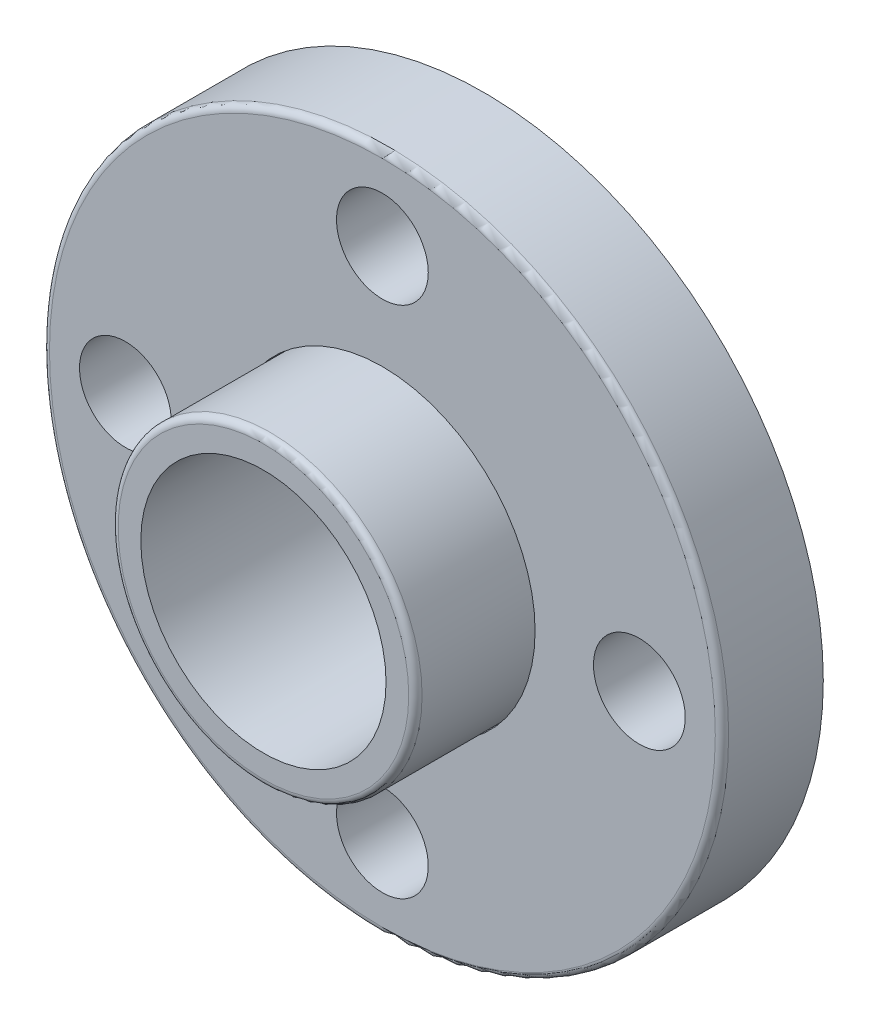
from build123d import *

# Parameters (mm, degrees)
SKETCH1_R                       = 58.7375
EXTRUDE1_DEPTH                  = 17.526
SKETCH2_R                       = 26.289
EXTRUDE2_DEPTH                  = 20.574
SKETCH3_R                       = 7.9375
EXTRUDE3_DEPTH                  = 86.577317605
CIRPATTERN1_COUNT               = 4
FILLET1_R                       = 1.154545455
CUT_REVOLVE_THIN1_OUTLINE_R     = 30.2895
CUT_REVOLVE_THIN1_OUTLINE_R_2   = 30.1625
CUT_REVOLVE_THIN1_DEPTH         = 8.312727273
CUT_REVOLVE_THIN1_START         = 8.185727273
CUT_REVOLVE_THIN1_2_OUTLINE_R   = 26.416
CUT_REVOLVE_THIN1_2_OUTLINE_R_2 = 26.289
CUT_REVOLVE_THIN1_2_DEPTH       = 9.340272727
CUT_REVOLVE_THIN1_3_OUTLINE_R   = 30.1625
CUT_REVOLVE_THIN1_3_OUTLINE_R_2 = 26.416
CUT_REVOLVE_THIN1_3_DEPTH       = 0.127


# Read off the part's stored shape, not the designer's step: Cut-Revolve-Thin1
with BuildPart() as part:
    # Sketch1 → Extrude1 (new body)
    with BuildSketch(Plane.XY):
        Circle(SKETCH1_R)
    extrude(amount=EXTRUDE1_DEPTH)

    # Sketch2 → Extrude2 (add)
    with BuildSketch(Plane.XY.offset(17.526)):
        Circle(SKETCH2_R)
    extrude(amount=EXTRUDE2_DEPTH)

    # Sketch3 → Extrude3 (cut, through all)
    with BuildSketch(Plane.XY.offset(17.526)):
        with Locations((0, 44.45)):
            Circle(SKETCH3_R)
    extrude3 = extrude(amount=-EXTRUDE3_DEPTH, mode=Mode.SUBTRACT)

    # CirPattern1: Extrude3 ×4 about axis
    cirpattern1_axis = Axis((0, 0, 0), (0, 0, 1))
    for i in range(1, CIRPATTERN1_COUNT):
        add(extrude3.rotate(cirpattern1_axis, i * 360 / CIRPATTERN1_COUNT), mode=Mode.SUBTRACT)

    # Fillet1
    fillet1_edges = [part.edges().sort_by_distance(p)[0] for p in [
        (-58.7375, 0, 17.526),
        (-26.289, 0, 38.1),
    ]]
    fillet(fillet1_edges, radius=FILLET1_R)

    # Sketch4 → Cut-Revolve1 (revolve, cut)
    with BuildSketch(Plane(origin=(0, 0, 62.70625), x_dir=(0, 0, 1), z_dir=(-1, 0, 0)), mode=Mode.PRIVATE) as cut_revolve1_sk:
        Polygon((-62.70625, 17.272), (-59.15025, 17.272), (-59.15025, 21.0185), (-24.60625, 21.209), (-24.60625, 0), (-62.70625, 0), align=None)
    revolve(cut_revolve1_sk.sketch.rotate(Axis((0, 0, 38.1), (0, 0, -1)), 90), axis=Axis((0, 0, 38.1), (0, 0, -1)), mode=Mode.SUBTRACT)

    # Cut-Revolve-Thin1 outline → Cut-Revolve-Thin1 (cut)
    with BuildSketch(Plane.XY):
        Circle(CUT_REVOLVE_THIN1_OUTLINE_R)
        Circle(CUT_REVOLVE_THIN1_OUTLINE_R_2, mode=Mode.SUBTRACT)
    extrude(amount=CUT_REVOLVE_THIN1_DEPTH, mode=Mode.SUBTRACT)

    # Cut-Revolve-Thin1 2 outline → Cut-Revolve-Thin1 2 (cut)
    with BuildSketch(Plane.XY.offset(CUT_REVOLVE_THIN1_START)):
        Circle(CUT_REVOLVE_THIN1_2_OUTLINE_R)
        Circle(CUT_REVOLVE_THIN1_2_OUTLINE_R_2, mode=Mode.SUBTRACT)
    extrude(amount=CUT_REVOLVE_THIN1_2_DEPTH, mode=Mode.SUBTRACT)

    # Cut-Revolve-Thin1 3 outline → Cut-Revolve-Thin1 3 (cut)
    with BuildSketch(Plane.XY.offset(CUT_REVOLVE_THIN1_START)):
        Circle(CUT_REVOLVE_THIN1_3_OUTLINE_R)
        Circle(CUT_REVOLVE_THIN1_3_OUTLINE_R_2, mode=Mode.SUBTRACT)
    extrude(amount=CUT_REVOLVE_THIN1_3_DEPTH, mode=Mode.SUBTRACT)


solid = part.part
